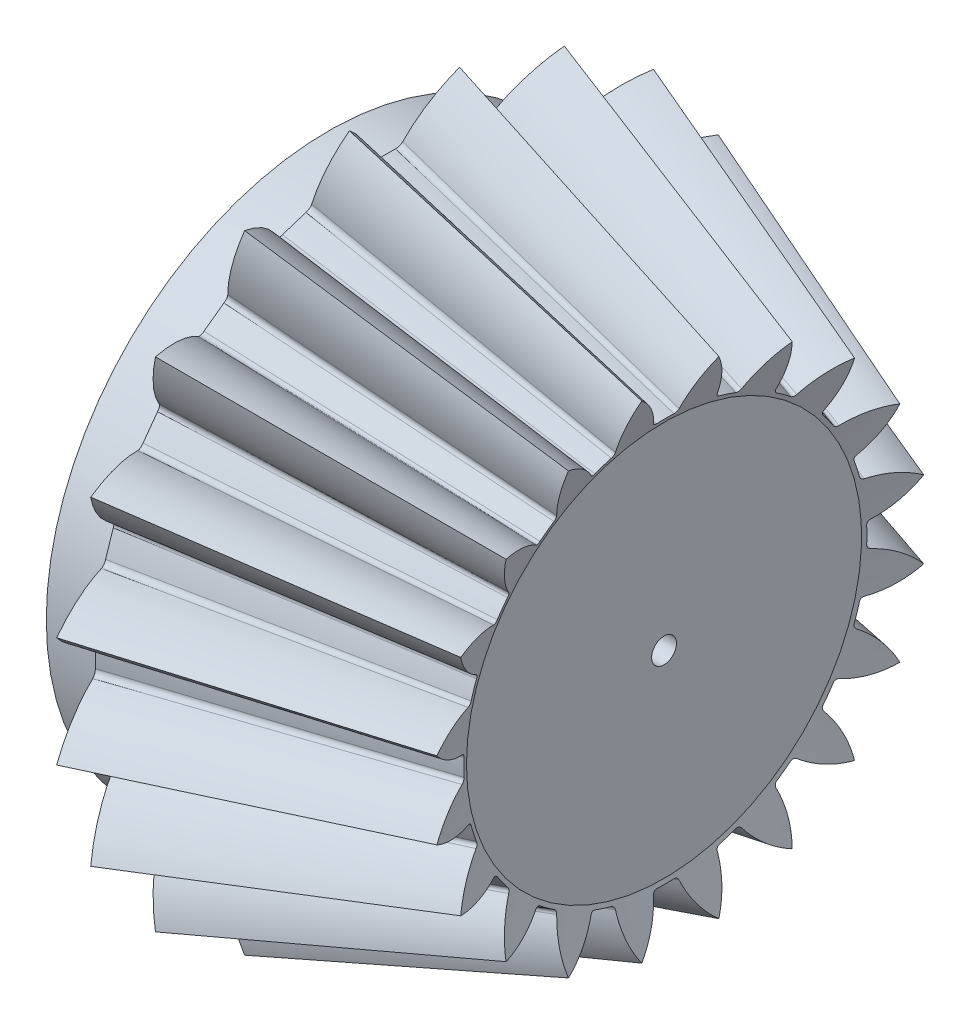
from build123d import *

# Parameters (mm, degrees)
TEETHCUTS_COUNT = 20
TEETHCUTS_ANGLE = 342
HUBSKE_R        = 11.343923992
HUB_DEPTH       = 2.114742931
BORSKE_R        = 0.5
BORE_DEPTH      = 40.0000508


with BuildPart() as part:
    # BasProSke → Base-Revolve (revolve)
    with BuildSketch(Plane(origin=(0, 0, 0), x_dir=(1, 0, 0), z_dir=(0, 1, 0)), mode=Mode.PRIVATE) as base_revolve_sk:
        Polygon((0, 0), (0, 11.343923992), (0.942270903, 14.170736697), (12.026560594, 9.918992721), (11.367005736, 7.94032815), (11.367005736, 0), align=None)
    revolve(base_revolve_sk.sketch.rotate(Axis((-10, 0, 0), (1, 0, 0)), 180), axis=Axis((-10, 0, 0), (1, 0, 0)))

    # ToothCut: read off the stored shape, not the designer's step
    # ToothCut: loft between two sections, ruled curve by curve
    toothcut_from = [
        Edge.make_bspline([(37.88767745, 0.006956341, -0.010369299), (37.885892164, 0.001600484, -0.014361559), (37.883722523, -0.004908441, -0.013502998), (37.882303375, -0.009165884, -0.008242695)], [0, 0, 0, 0, 1, 1, 1, 1], 3, [1, 0.825647036, 0.825647036, 1]),
        Edge.make_bspline([(37.882303375, -0.009165884, 0.008242695), (37.883722523, -0.004908441, 0.013502998), (37.885892164, 0.001600484, 0.014361559), (37.88767745, 0.006956341, 0.010369299)], [0, 0, 0, 0, 1, 1, 1, 1], 3, [1, 0.825647036, 0.825647036, 1]),
        Edge.make_bspline([(37.882303375, -0.009165884, -0.008242695), (37.882077887, -0.009842348, -0.007406887), (37.88188839, -0.01041084, -0.006486055), (37.881738052, -0.010861854, -0.005495596)], [0, 0, 0, 0, 1, 1, 1, 1], 3, [1, 0.99442642, 0.99442642, 1]),
        Edge.make_bspline([(37.881738052, -0.010861854, 0.005495596), (37.88188839, -0.01041084, 0.006486055), (37.882077887, -0.009842348, 0.007406887), (37.882303375, -0.009165884, 0.008242695)], [0, 0, 0, 0, 1, 1, 1, 1], 3, [1, 0.99442642, 0.99442642, 1]),
        Edge.make_bspline([(37.881738052, -0.010861854, -0.005495596), (37.881201484, -0.012471558, -0.001960575), (37.881201484, -0.012471558, 0.001960575), (37.881738052, -0.010861854, 0.005495596)], [0, 0, 0, 0, 1, 1, 1, 1], 3, [1, 0.934350924, 0.934350924, 1]),
        Edge.make_line((37.88767745, 0.006956341, 0.010369299), (37.88767745, 0.006956341, -0.010369299)),
    ]
    toothcut_to = [
        Edge.make_bspline([(0.963021432, 14.232988284, -2.518058706), (0.751928813, 13.59971043, -1.643199156), (0.463681766, 12.734969288, -1.026663217), (0.128333487, 11.728924453, -0.732732125)], [0, 0, 0, 0, 1, 1, 1, 1], 3, [1, 0.965246018, 0.965246018, 1]),
        Edge.make_bspline([(0.128333487, 11.728924453, 0.732732125), (0.463681766, 12.734969288, 1.026663217), (0.751928813, 13.59971043, 1.643199156), (0.963021432, 14.232988284, 2.518058706)], [0, 0, 0, 0, 1, 1, 1, 1], 3, [1, 0.965246018, 0.965246018, 1]),
        Edge.make_bspline([(0.128333487, 11.728924453, -0.732732125), (0.093443522, 11.624254557, -0.702151244), (0.072150863, 11.560376581, -0.609552573), (0.073706397, 11.565043182, -0.495166865)], [0, 0, 0, 0, 1, 1, 1, 1], 3, [1, 0.855178792, 0.855178792, 1]),
        Edge.make_bspline([(0.073706397, 11.565043182, 0.495166865), (0.072150863, 11.560376581, 0.609552573), (0.093443522, 11.624254557, 0.702151244), (0.128333487, 11.728924453, 0.732732125)], [0, 0, 0, 0, 1, 1, 1, 1], 3, [1, 0.855178792, 0.855178792, 1]),
        Edge.make_bspline([(0.073706397, 11.565043182, -0.495166865), (0.078194204, 11.578506604, -0.165157291), (0.078194204, 11.578506604, 0.165157291), (0.073706397, 11.565043182, 0.495166865)], [0, 0, 0, 0, 1, 1, 1, 1], 3, [1, 0.999384409, 0.999384409, 1]),
        Edge.make_line((0.963021432, 14.232988284, 2.518058706), (0.963021432, 14.232988284, -2.518058706)),
    ]
    toothcut = Solid(Shell([*[Face.make_surface_from_curves(toothcut_from[k], toothcut_to[k]) for k in range(6)], Face(Wire(toothcut_from)), Face(Wire(toothcut_to))]))
    add(toothcut, mode=Mode.SUBTRACT)

    # TeethCuts: ToothCut ×20 about axis
    teethcuts_axis = Axis((-10, 0, 0), (1, 0, 0))
    for i in range(1, TEETHCUTS_COUNT):
        add(toothcut.rotate(teethcuts_axis, i * TEETHCUTS_ANGLE / (TEETHCUTS_COUNT - 1)), mode=Mode.SUBTRACT)

    # HubSke → Hub (add)
    with BuildSketch(Plane.ZY):
        Circle(HUBSKE_R)
    extrude(amount=HUB_DEPTH)

    # BorSke → Bore (cut, symmetric)
    with BuildSketch(Plane(origin=(0, 0, 0), x_dir=(0, 0, -1), z_dir=(1, 0, 0))):
        with Locations(Location((0, 0, 0), (0, 0, 180))):
            Circle(BORSKE_R)
    extrude(amount=BORE_DEPTH, both=True, mode=Mode.SUBTRACT)


solid = part.part
